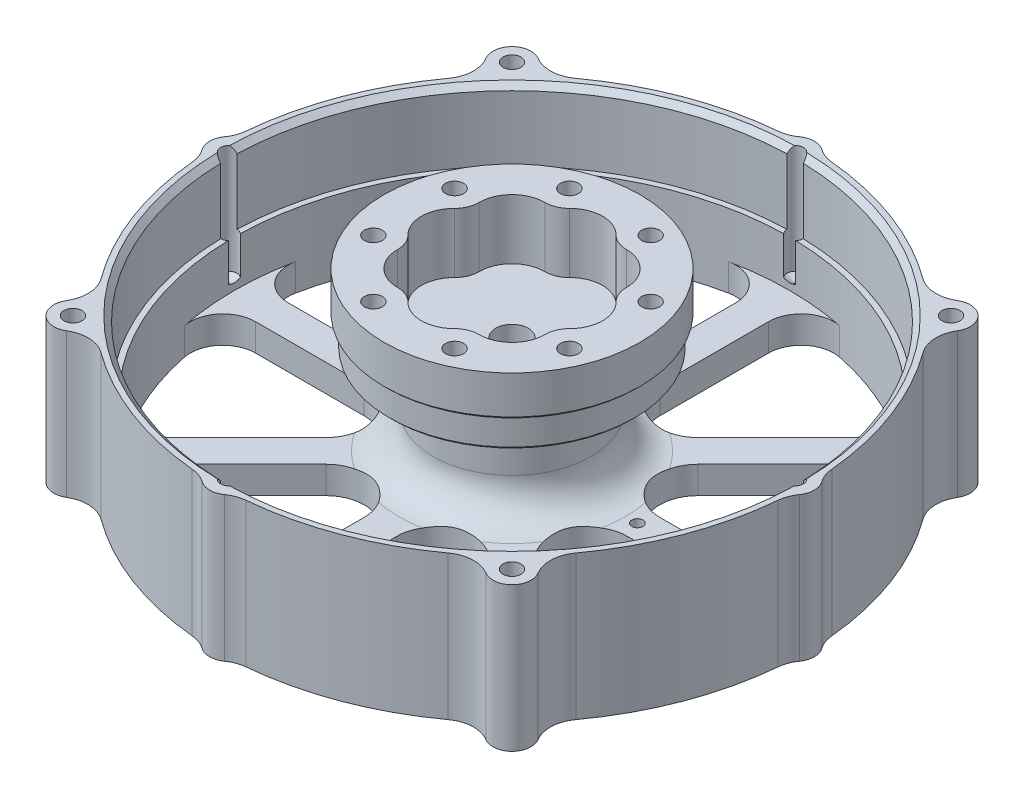
from build123d import *
from build123d.topology import SkipClean

# Parameters (mm, degrees)
CHAMFER1_SIZE                = 0.5
M4X0_7_TAPPED_HOLE1_REACH    = 89.641
M4X0_7_TAPPED_HOLE1_BORE_R   = 1.65
F_6_0_6_DIAMETER_HOLE1_D     = 6
F_6_0_6_DIAMETER_HOLE1_DEPTH = 27
F_6_0_6_DIAMETER_HOLE1_TIP   = 1.802581857
CHAMFER2_SIZE                = 1
F_3_0_3_DIAMETER_HOLE1_D     = 3
F_3_0_3_DIAMETER_HOLE1_DEPTH = 20
F_3_0_3_DIAMETER_HOLE1_TIP   = 0.901290929
M2_5X0_45_TAPPED_HOLE1_D     = 2.05
M2_5X0_45_TAPPED_HOLE1_DEPTH = 5
M2_5X0_45_TAPPED_HOLE1_TIP   = 0.615882135
CUT_EXTRUDE1_START           = 10
CUT_EXTRUDE1_DEPTH           = 10
CIRPATTERN5_COUNT            = 8
FILLET1_R                    = 6
BOSS_EXTRUDE1_START          = -26.49996
BOSS_EXTRUDE1_DEPTH          = 26.49996
M4X0_7_TAPPED_HOLE2_D        = 3.3
FILLET2_R                    = 6
SKETCH23_R                   = 15
CUT_EXTRUDE3_DEPTH           = 11.00088
CUT_EXTRUDE4_DEPTH           = 11.00088
CIRPATTERN6_COUNT            = 8


with BuildPart() as part:
    # Sketch1 → Revolve1 (revolve)
    with BuildSketch(Plane.XY, mode=Mode.PRIVATE) as revolve1_sk:
        Polygon((0, 0), (-23.5, 0), (-23.5, -7.50088), (-22.49932, -7.50088), (-22.49932, -13.00088), (-7.366, -13.00088), (-7.366, -13.50088), (-4.7625, -13.50088), (-4.7625, -32.26424), (-4.4704, -32.26424), (-4.4704, -33.00084), (-4.7625, -33.00084), (-4.7625, -33.50084), (-4.2625, -34.00084), (-3.175, -34.00084), (-3.175, -43.00006), (0, -43.00006), align=None)
        with BuildLine():
            Line((-11.1125, -20.64082), (-11.1125, -13.50088))
            Line((-11.1125, -13.50088), (-14.5, -13.50088))
            Line((-14.5, -13.50088), (-14.5, -22.65084))
            ThreePointArc((-14.5, -22.65084), (-16.359871939, -27.140968061), (-20.85, -29.00084))
            Line((-20.85, -29.00084), (-51.00066, -29.00084))
            Line((-51.00066, -29.00084), (-51.00066, -20.5006))
            Line((-51.00066, -20.5006), (-52, -20.5006))
            Line((-52, -20.5006), (-52, -7.50088))
            Line((-52, -7.50088), (-54, -7.50088))
            Line((-54, -7.50088), (-54, -34.00084))
            Line((-54, -34.00084), (-14.1125, -34.00084))
            Line((-14.1125, -34.00084), (-14.1125, -32.26424))
            Line((-14.1125, -32.26424), (-11.1125, -32.26424))
            Line((-11.1125, -32.26424), (-11.1125, -25.1243))
            Line((-11.1125, -25.1243), (-9, -25.1243))
            Line((-9, -25.1243), (-9, -20.64082))
            Line((-9, -20.64082), (-11.1125, -20.64082))
        make_face()
    revolve(revolve1_sk.sketch.rotate(Axis((0, -34.00084, 0), (0, 1, 0)), 180), axis=Axis((0, -34.00084, 0), (0, 1, 0)))

    # Chamfer1
    chamfer1_edges = [part.edges().sort_by_distance(p)[0] for p in [
        (-22.49932, -13.00088, 0),
        (-23.5, -7.50088, 0),
        (-3.175, -43.00006, 0),
    ]]
    chamfer(chamfer1_edges, length=CHAMFER1_SIZE)

    # M4x0.7 Tapped Hole1 bore → M4x0.7 Tapped Hole1 (cut, up to next)
    with BuildSketch(Plane(origin=(0, 0, 0), x_dir=(1, 0, 0), z_dir=(0, 1, 0)), mode=Mode.PRIVATE) as m4x0_7_tapped_hole1_sk1:
        with Locations((-18, 7.455844123)):
            Circle(M4X0_7_TAPPED_HOLE1_BORE_R)
    m4x0_7_tapped_hole1_tool1 = extrude(m4x0_7_tapped_hole1_sk1.sketch, amount=-M4X0_7_TAPPED_HOLE1_REACH, mode=Mode.PRIVATE) & part.part
    # M4x0.7 Tapped Hole1 bore → M4x0.7 Tapped Hole1 (cut, up to next)
    with BuildSketch(Plane(origin=(0, 0, 0), x_dir=(1, 0, 0), z_dir=(0, 1, 0)), mode=Mode.PRIVATE) as m4x0_7_tapped_hole1_sk2:
        with Locations((-18, -7.455844123)):
            Circle(M4X0_7_TAPPED_HOLE1_BORE_R)
    m4x0_7_tapped_hole1_tool2 = extrude(m4x0_7_tapped_hole1_sk2.sketch, amount=-M4X0_7_TAPPED_HOLE1_REACH, mode=Mode.PRIVATE) & part.part
    # M4x0.7 Tapped Hole1 bore → M4x0.7 Tapped Hole1 (cut, up to next)
    with BuildSketch(Plane(origin=(0, 0, 0), x_dir=(1, 0, 0), z_dir=(0, 1, 0)), mode=Mode.PRIVATE) as m4x0_7_tapped_hole1_sk3:
        with Locations((-7.455844123, -18)):
            Circle(M4X0_7_TAPPED_HOLE1_BORE_R)
    m4x0_7_tapped_hole1_tool3 = extrude(m4x0_7_tapped_hole1_sk3.sketch, amount=-M4X0_7_TAPPED_HOLE1_REACH, mode=Mode.PRIVATE) & part.part
    # M4x0.7 Tapped Hole1 bore → M4x0.7 Tapped Hole1 (cut, up to next)
    with BuildSketch(Plane(origin=(0, 0, 0), x_dir=(1, 0, 0), z_dir=(0, 1, 0)), mode=Mode.PRIVATE) as m4x0_7_tapped_hole1_sk4:
        with Locations((7.455844123, -18)):
            Circle(M4X0_7_TAPPED_HOLE1_BORE_R)
    m4x0_7_tapped_hole1_tool4 = extrude(m4x0_7_tapped_hole1_sk4.sketch, amount=-M4X0_7_TAPPED_HOLE1_REACH, mode=Mode.PRIVATE) & part.part
    # M4x0.7 Tapped Hole1 bore → M4x0.7 Tapped Hole1 (cut, up to next)
    with BuildSketch(Plane(origin=(0, 0, 0), x_dir=(1, 0, 0), z_dir=(0, 1, 0)), mode=Mode.PRIVATE) as m4x0_7_tapped_hole1_sk5:
        with Locations((18, -7.455844123)):
            Circle(M4X0_7_TAPPED_HOLE1_BORE_R)
    m4x0_7_tapped_hole1_tool5 = extrude(m4x0_7_tapped_hole1_sk5.sketch, amount=-M4X0_7_TAPPED_HOLE1_REACH, mode=Mode.PRIVATE) & part.part
    # M4x0.7 Tapped Hole1 bore → M4x0.7 Tapped Hole1 (cut, up to next)
    with BuildSketch(Plane(origin=(0, 0, 0), x_dir=(1, 0, 0), z_dir=(0, 1, 0)), mode=Mode.PRIVATE) as m4x0_7_tapped_hole1_sk6:
        with Locations((18, 7.455844123)):
            Circle(M4X0_7_TAPPED_HOLE1_BORE_R)
    m4x0_7_tapped_hole1_tool6 = extrude(m4x0_7_tapped_hole1_sk6.sketch, amount=-M4X0_7_TAPPED_HOLE1_REACH, mode=Mode.PRIVATE) & part.part
    # M4x0.7 Tapped Hole1 bore → M4x0.7 Tapped Hole1 (cut, up to next)
    with BuildSketch(Plane(origin=(0, 0, 0), x_dir=(1, 0, 0), z_dir=(0, 1, 0)), mode=Mode.PRIVATE) as m4x0_7_tapped_hole1_sk7:
        with Locations((7.455844123, 18)):
            Circle(M4X0_7_TAPPED_HOLE1_BORE_R)
    m4x0_7_tapped_hole1_tool7 = extrude(m4x0_7_tapped_hole1_sk7.sketch, amount=-M4X0_7_TAPPED_HOLE1_REACH, mode=Mode.PRIVATE) & part.part
    # M4x0.7 Tapped Hole1 bore → M4x0.7 Tapped Hole1 (cut, up to next)
    with BuildSketch(Plane(origin=(0, 0, 0), x_dir=(1, 0, 0), z_dir=(0, 1, 0)), mode=Mode.PRIVATE) as m4x0_7_tapped_hole1_sk8:
        with Locations((-7.455844123, 18)):
            Circle(M4X0_7_TAPPED_HOLE1_BORE_R)
    m4x0_7_tapped_hole1_tool8 = extrude(m4x0_7_tapped_hole1_sk8.sketch, amount=-M4X0_7_TAPPED_HOLE1_REACH, mode=Mode.PRIVATE) & part.part
    add(m4x0_7_tapped_hole1_tool1.solids().sort_by_distance((-18, 0, -7.455844))[0], mode=Mode.SUBTRACT)
    add(m4x0_7_tapped_hole1_tool2.solids().sort_by_distance((-18, 0, 7.455844))[0], mode=Mode.SUBTRACT)
    add(m4x0_7_tapped_hole1_tool3.solids().sort_by_distance((-7.455844, 0, 18))[0], mode=Mode.SUBTRACT)
    add(m4x0_7_tapped_hole1_tool4.solids().sort_by_distance((7.455844, 0, 18))[0], mode=Mode.SUBTRACT)
    add(m4x0_7_tapped_hole1_tool5.solids().sort_by_distance((18, 0, 7.455844))[0], mode=Mode.SUBTRACT)
    add(m4x0_7_tapped_hole1_tool6.solids().sort_by_distance((18, 0, -7.455844))[0], mode=Mode.SUBTRACT)
    add(m4x0_7_tapped_hole1_tool7.solids().sort_by_distance((7.455844, 0, -18))[0], mode=Mode.SUBTRACT)
    add(m4x0_7_tapped_hole1_tool8.solids().sort_by_distance((-7.455844, 0, -18))[0], mode=Mode.SUBTRACT)

    # Ø6.0 (6) Diameter Hole1
    with Locations(Plane(origin=(0, 0, 0), x_dir=(1, 0, 0), z_dir=(0, 1, 0))):
        with Locations((0, 0)):
            Hole(F_6_0_6_DIAMETER_HOLE1_D / 2, depth=F_6_0_6_DIAMETER_HOLE1_DEPTH)
            with Locations((0, 0, -(F_6_0_6_DIAMETER_HOLE1_DEPTH + F_6_0_6_DIAMETER_HOLE1_TIP / 2))):  # 118° drill point
                Cone(0, F_6_0_6_DIAMETER_HOLE1_D / 2, F_6_0_6_DIAMETER_HOLE1_TIP, mode=Mode.SUBTRACT)

    # Chamfer2
    chamfer2_edges = [part.edges().sort_by_distance(p)[0] for p in [
        (-52, -7.50088, 0),
    ]]
    chamfer(chamfer2_edges, length=CHAMFER2_SIZE)

    # Ø3.0 (3) Diameter Hole1
    with Locations(Plane(origin=(0, -7.50088, 0), x_dir=(1, 0, 0), z_dir=(0, 1, 0))):
        with Locations((0, 52), (-52, 0), (0, -52), (52, 0)):
            Hole(F_3_0_3_DIAMETER_HOLE1_D / 2, depth=F_3_0_3_DIAMETER_HOLE1_DEPTH)
            with Locations((0, 0, -(F_3_0_3_DIAMETER_HOLE1_DEPTH + F_3_0_3_DIAMETER_HOLE1_TIP / 2))):  # 118° drill point
                Cone(0, F_3_0_3_DIAMETER_HOLE1_D / 2, F_3_0_3_DIAMETER_HOLE1_TIP, mode=Mode.SUBTRACT)

    # M2.5x0.45 Tapped Hole1
    with Locations(Plane(origin=(0, -34.00084, 0), x_dir=(-1, 0, 0), z_dir=(0, -1, 0))):
        with Locations((-23.0125, 0), (23.0125, 0)):
            Hole(M2_5X0_45_TAPPED_HOLE1_D / 2, depth=M2_5X0_45_TAPPED_HOLE1_DEPTH)
            with Locations((0, 0, -(M2_5X0_45_TAPPED_HOLE1_DEPTH + M2_5X0_45_TAPPED_HOLE1_TIP / 2))):  # 118° drill point
                Cone(0, M2_5X0_45_TAPPED_HOLE1_D / 2, M2_5X0_45_TAPPED_HOLE1_TIP, mode=Mode.SUBTRACT)

    # Sketch14 → Cut-Extrude1 (cut)
    with SkipClean():  # the faces are left unmerged after this step: merging them gives an invalid solid
        with BuildSketch(Plane(origin=(0, -34.00084, 0), x_dir=(1, 0, 0), z_dir=(0, 1, 0)).offset(CUT_EXTRUDE1_START)):
            with BuildLine():
                Line((-14.949747468, 19.192388155), (-33.879147156, 38.121787844))
                ThreePointArc((-33.879147156, 38.121787844), (-19.517107622, 47.118465919), (-3, 50.91234939))
                Line((-3, 50.91234939), (-3, 24.142135624))
                ThreePointArc((-3, 24.142135624), (-7.321215973, 17.674978896), (-14.949747468, 19.192388155))
            make_face()
        cut_extrude1 = extrude(amount=-CUT_EXTRUDE1_DEPTH, mode=Mode.SUBTRACT)
    add(part.part.scale(1), mode=Mode.REPLACE)  # the faces are merged on a copy

    # CirPattern5: Cut-Extrude1 ×8 about axis
    cirpattern5_axis = Axis((0, 0, 0), (0, 1, 0))
    for i in range(1, CIRPATTERN5_COUNT):
        add(cut_extrude1.rotate(cirpattern5_axis, i * 360 / CIRPATTERN5_COUNT), mode=Mode.SUBTRACT)

    # Fillet1
    # the kernel refuses this fillet: 6 mm, written as the material it adds along each edge
    with BuildSketch(Plane(origin=(-3, -29.00084, -50.91234939), x_dir=(-0.991548168305779, 0, 0.12973908404738624), z_dir=(0, -1, 0)), Plane(origin=(-33.879147156, -29.00084, 38.121787844), x_dir=(0.7928698197969543, 0, 0.6093910475672786), z_dir=(0, -1, 0)), Plane(origin=(3, -29.00084, 50.91234939), x_dir=(0.9915481683057791, 0, -0.12973908404738524), z_dir=(0, -1, 0)), Plane(origin=(38.121787844, -29.00084, 33.879147156), x_dir=(0.6093910475672776, 0, -0.7928698197969551), z_dir=(0, -1, 0)), Plane(origin=(50.91234939, -29.00084, -3), x_dir=(-0.12973908404738616, 0, -0.991548168305779), z_dir=(0, -1, 0)), Plane(origin=(-50.91234939, -29.00084, 3), x_dir=(0.12973908404738513, 0, 0.9915481683057791), z_dir=(0, -1, 0)), Plane(origin=(-38.121787844, -29.00084, -33.879147156), x_dir=(-0.6093910475672784, 0, 0.7928698197969544), z_dir=(0, -1, 0)), Plane(origin=(33.879147156, -29.00084, -38.121787844), x_dir=(-0.7928698197969549, 0, -0.6093910475672778), z_dir=(0, -1, 0))) as fillet1_piece_1:
        with BuildLine():
            CenterArc((6.834221192, -5.984777142), FILLET1_R, 85.917727745, 101.536787502)
            Line((0.884932182, -6.763211646), (0, 0))
            ThreePointArc((0, 0), (3.630677072, 0.129395966), (7.261354143, 0))
        make_face()
    extrude(amount=5)
    with BuildSketch(Plane(origin=(-33.879147156, -29.00084, -38.121787844), x_dir=(0.7928698197969535, 0, -0.6093910475672796), z_dir=(0, -1, 0))) as fillet1_piece_2:
        with BuildLine():
            CenterArc((6.834221192, 5.984777142), FILLET1_R, 172.545484753, 101.536787502)
            Line((0.884932182, 6.763211646), (0, 0))
            ThreePointArc((0, 0), (3.630677072, -0.129395966), (7.261354143, 0))
        make_face()
    extrude(amount=5)
    with BuildSketch(Plane(origin=(-3, -29.00084, 50.91234939), x_dir=(0, 0, -1), z_dir=(0, -1, 0)), Plane(origin=(33.879147156, -29.00084, 38.121787844), x_dir=(-0.7071067811865472, 0, -0.7071067811865478), z_dir=(0, -1, 0)), Plane(origin=(50.91234939, -29.00084, 3), x_dir=(-1, 0, 0), z_dir=(0, -1, 0)), Plane(origin=(38.121787844, -29.00084, -33.879147156), x_dir=(-0.7071067811865476, 0, 0.7071067811865476), z_dir=(0, -1, 0)), Plane(origin=(-38.121787844, -29.00084, 33.879147156), x_dir=(0.7071067811865486, 0, -0.7071067811865465), z_dir=(0, -1, 0)), Plane(origin=(-50.91234939, -29.00084, -3), x_dir=(1, 0, 0), z_dir=(0, -1, 0)), Plane(origin=(3, -29.00084, -50.91234939), x_dir=(0, 0, 1), z_dir=(0, -1, 0))) as fillet1_piece_3:
        with BuildLine():
            CenterArc((6.820860411, -6), FILLET1_R, 90, 101.536787502)
            ThreePointArc((0.942081436, -7.1999824), (0.342738385, -3.616778914), (0, 0))
            Line((0, 0), (6.820860411, 0))
        make_face()
    extrude(amount=5)

    # Sketch15 → Boss-Extrude1 (add)
    with SkipClean():  # the faces are left unmerged after this step: merging them gives an invalid solid
        with BuildSketch(Plane(origin=(0, -7.50088, 0), x_dir=(1, 0, 0), z_dir=(0, 1, 0)).offset(BOSS_EXTRUDE1_START)):
            with BuildLine():
                ThreePointArc((-39.404198954, 36.923015922), (-42.779960262, 42.779960262), (-36.923015922, 39.404198954))
                ThreePointArc((-36.923015922, 39.404198954), (-38.183766184, 38.183766184), (-39.404198954, 36.923015922))
            make_face()
            with BuildLine():
                ThreePointArc((-39.404198954, -36.923015922), (-38.183766184, -38.183766184), (-36.923015922, -39.404198954))
                ThreePointArc((-36.923015922, -39.404198954), (-42.779960262, -42.779960262), (-39.404198954, -36.923015922))
            make_face()
            with BuildLine():
                ThreePointArc((36.923015922, 39.404198954), (42.779960262, 42.779960262), (39.404198954, 36.923015922))
                ThreePointArc((39.404198954, 36.923015922), (38.183766184, 38.183766184), (36.923015922, 39.404198954))
            make_face()
            with BuildLine():
                ThreePointArc((39.404198954, -36.923015922), (42.779960262, -42.779960262), (36.923015922, -39.404198954))
                ThreePointArc((36.923015922, -39.404198954), (38.183766184, -38.183766184), (39.404198954, -36.923015922))
            make_face()
            with BuildLine():
                ThreePointArc((-53.920673077, -2.925921211), (-55.5, 0), (-53.920673077, 2.925921211))
                ThreePointArc((-53.920673077, 2.925921211), (-54, 0), (-53.920673077, -2.925921211))
            make_face()
            with BuildLine():
                ThreePointArc((-2.925921211, 53.920673077), (0, 55.5), (2.925921211, 53.920673077))
                ThreePointArc((2.925921211, 53.920673077), (0, 54), (-2.925921211, 53.920673077))
            make_face()
            with BuildLine():
                ThreePointArc((53.920673077, -2.925921211), (55.5, 0), (53.920673077, 2.925921211))
                ThreePointArc((53.920673077, 2.925921211), (54, 0), (53.920673077, -2.925921211))
            make_face()
            with BuildLine():
                ThreePointArc((-2.925921211, -53.920673077), (0, -55.5), (2.925921211, -53.920673077))
                ThreePointArc((2.925921211, -53.920673077), (0, -54), (-2.925921211, -53.920673077))
            make_face()
        extrude(amount=BOSS_EXTRUDE1_DEPTH)

    # M4x0.7 Tapped Hole2 (through all)
    with Locations(Plane(origin=(0, -7.50088, 0), x_dir=(1, 0, 0), z_dir=(0, 1, 0))):
        with Locations((-40.305086528, 40.305086528), (-40.305086528, -40.305086528), (40.305086528, -40.305086528), (40.305086528, 40.305086528)):
            Hole(M4X0_7_TAPPED_HOLE2_D / 2)

    # Fillet2
    # the kernel refuses this fillet: 6 mm, written as the material it adds along each edge
    with BuildSketch(Plane(origin=(-36.923015922, -34.00084, -39.404198954), x_dir=(0.7699670812458109, 0, -0.6380836103504045), z_dir=(0, 1, 0)), Plane(origin=(39.404198954, -34.00084, -36.923015922), x_dir=(0.6380836103504051, 0, 0.7699670812458106), z_dir=(0, 1, 0)), Plane(origin=(36.923015922, -34.00084, 39.404198954), x_dir=(-0.7699670812458114, 0, 0.6380836103504038), z_dir=(0, 1, 0)), Plane(origin=(-39.404198954, -34.00084, 36.923015922), x_dir=(-0.6380836103504046, 0, -0.7699670812458108), z_dir=(0, 1, 0))) as fillet2_piece_1:
        with BuildLine():
            CenterArc((6.937814679, 5.988878596), FILLET2_R, 199.282710573, 67.228225526)
            ThreePointArc((1.274410816, 4.007501123), (1.306167847, 1.791016256), (0, 0))
            ThreePointArc((0, 0), (3.286333269, 0.100092638), (6.572666538, 0))
        make_face()
    extrude(amount=26.49996)
    with BuildSketch(Plane(origin=(-39.404198954, -34.00084, -36.923015922), x_dir=(-0.6380836103504035, 0, 0.7699670812458117), z_dir=(0, 1, 0)), Plane(origin=(36.923015922, -34.00084, -39.404198954), x_dir=(-0.7699670812458117, 0, -0.6380836103504036), z_dir=(0, 1, 0)), Plane(origin=(39.404198954, -34.00084, 36.923015922), x_dir=(0.6380836103504054, 0, -0.7699670812458103), z_dir=(0, 1, 0)), Plane(origin=(-36.923015922, -34.00084, 39.404198954), x_dir=(0.769967081245811, 0, 0.6380836103504045), z_dir=(0, 1, 0))) as fillet2_piece_2:
        with BuildLine():
            CenterArc((6.937814679, -5.988878596), FILLET2_R, 93.489063901, 67.228225526)
            ThreePointArc((1.274410816, -4.007501123), (1.306167847, -1.791016256), (0, 0))
            ThreePointArc((0, 0), (3.286333269, -0.100092638), (6.572666538, 0))
        make_face()
    extrude(amount=26.49996)
    with BuildSketch(Plane(origin=(-53.920673077, -34.00084, -2.925921211), x_dir=(0.07291891596041469, 0, -0.997337872385862), z_dir=(0, 1, 0)), Plane(origin=(2.925921211, -34.00084, -53.920673077), x_dir=(0.997337872385862, 0, 0.07291891596041489), z_dir=(0, 1, 0)), Plane(origin=(53.920673077, -34.00084, 2.925921211), x_dir=(-0.07291891596041995, 0, 0.9973378723858616), z_dir=(0, 1, 0)), Plane(origin=(-2.925921211, -34.00084, 53.920673077), x_dir=(-0.9973378723858618, 0, -0.07291891596041811), z_dir=(0, 1, 0))) as fillet2_piece_3:
        with BuildLine():
            CenterArc((2.140043875, 5.998942707), FILLET2_R, 238.822095658, 30.102266756)
            ThreePointArc((-0.966138764, 0.86555889), (-0.442620325, 0.477928773), (0, 0))
            ThreePointArc((0, 0), (1.013704994, 0.009515633), (2.027409987, 0))
        make_face()
    extrude(amount=26.49996)
    with BuildSketch(Plane(origin=(-53.920673077, -34.00084, 2.925921211), x_dir=(0.07291891596041877, 0, 0.9973378723858618), z_dir=(0, 1, 0)), Plane(origin=(-2.925921211, -34.00084, -53.920673077), x_dir=(-0.997337872385862, 0, 0.07291891596041554), z_dir=(0, 1, 0)), Plane(origin=(53.920673077, -34.00084, -2.925921211), x_dir=(-0.07291891596042092, 0, -0.9973378723858616), z_dir=(0, 1, 0)), Plane(origin=(2.925921211, -34.00084, 53.920673077), x_dir=(0.997337872385862, 0, -0.07291891596041536), z_dir=(0, 1, 0))) as fillet2_piece_4:
        with BuildLine():
            CenterArc((2.140043875, -5.998942707), FILLET2_R, 91.075637586, 30.102266756)
            ThreePointArc((-0.966138764, -0.86555889), (-0.442620325, -0.477928773), (0, 0))
            ThreePointArc((0, 0), (1.013704994, -0.009515633), (2.027409987, 0))
        make_face()
    extrude(amount=26.49996)

    # Sketch23 → Cut-Extrude3 (cut)
    with BuildSketch(Plane(origin=(0, 0, 0), x_dir=(1, 0, 0), z_dir=(0, 1, 0))):
        with Locations(Location((0, 0, 0), (0, 0, 180))):
            Circle(SKETCH23_R)
    extrude(amount=-CUT_EXTRUDE3_DEPTH, mode=Mode.SUBTRACT)

    # Sketch24 → Cut-Extrude4 (cut)
    with BuildSketch(Plane(origin=(0, 0, 0), x_dir=(1, 0, 0), z_dir=(0, 1, 0))):
        with BuildLine():
            ThreePointArc((-4.267367202, 14.848581534), (0, 16.630812317), (4.267367202, 14.848581534))
            ThreePointArc((4.267367202, 14.848581534), (4.954306211, 14.279767279), (5.740251485, 13.858192988))
            ThreePointArc((5.740251485, 13.858192988), (0, 15), (-5.740251485, 13.858192988))
            ThreePointArc((-5.740251485, 13.858192988), (-4.954306211, 14.279767279), (-4.267367202, 14.848581534))
        make_face()
    cut_extrude4 = extrude(amount=-CUT_EXTRUDE4_DEPTH, mode=Mode.SUBTRACT)

    # CirPattern6: Cut-Extrude4 ×8 about axis
    cirpattern6_axis = Axis((0, 0, 0), (0, 1, 0))
    for i in range(1, CIRPATTERN6_COUNT):
        add(cut_extrude4.rotate(cirpattern6_axis, i * 360 / CIRPATTERN6_COUNT), mode=Mode.SUBTRACT)


solid = part.part
